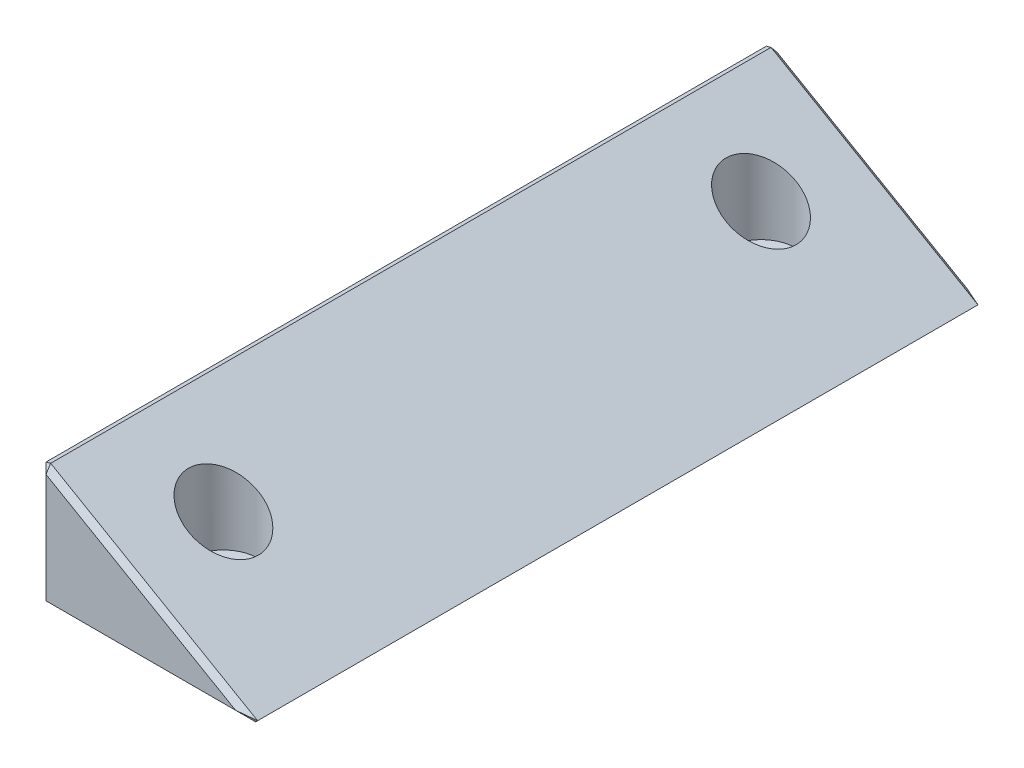
from build123d import *

# Parameters (mm, degrees)
BOSS_EXTRUDE1_DEPTH                                 = 34
CBORE_FOR_M3_HEX_SOCKET_HEAD_CAP_SCREW1_D           = 3.4
CBORE_FOR_M3_HEX_SOCKET_HEAD_CAP_SCREW1_CBORE_D     = 6.5
CBORE_FOR_M3_HEX_SOCKET_HEAD_CAP_SCREW1_CBORE_DEPTH = 10


with BuildPart() as part:
    # Sketch1 → Boss-Extrude1 (new, symmetric)
    with BuildSketch(Plane.XY):
        Polygon((0, 0), (0, -11.547005384), (20, -11.547005384), align=None)
    extrude(amount=BOSS_EXTRUDE1_DEPTH, both=True)

    # CBORE for M3 Hex Socket Head Cap Screw1 (through all)
    with Locations(Plane(origin=(0, 0, 0), x_dir=(1, 0, 0), z_dir=(0, 1, 0))):
        with Locations((8, -25), (8, 25)):
            CounterBoreHole(CBORE_FOR_M3_HEX_SOCKET_HEAD_CAP_SCREW1_D / 2, CBORE_FOR_M3_HEX_SOCKET_HEAD_CAP_SCREW1_CBORE_D / 2, CBORE_FOR_M3_HEX_SOCKET_HEAD_CAP_SCREW1_CBORE_DEPTH)

    # Chamfer1
    # the kernel refuses this chamfer: 0.5, 0.366025404 mm, written as the material it takes off along each edge
    with BuildSketch(Plane(origin=(0.333333333, -11.21367205, 33.666666667), x_dir=(0.7071067811865475, -0.7071067811865476, 0), z_dir=(-0.5773502691896258, -0.5773502691896257, 0.5773502691896256)), Plane(origin=(0.333333333, -11.21367205, -33.666666667), x_dir=(0.7071067811865474, 0, -0.7071067811865476), z_dir=(-0.5773502691896258, -0.5773502691896257, -0.5773502691896257))) as chamfer1_piece_1:
        Polygon((-0.353553391, -0.204124145), (0.353553391, -0.204124145), (0, 0.40824829), align=None)
    extrude(amount=0.635085296, mode=Mode.SUBTRACT)
    with BuildSketch(Plane(origin=(19.105662433, -11.319334483, 33.666666667), x_dir=(-0.8880738339771186, 0.3250575836718637, 0.3250575836718637), z_dir=(0.25056280708572953, -0.2505628070857271, 0.9351131265310311))) as chamfer1_piece_2:
        Polygon((-0.478383292, 0.07914139), (1.059805709, 0.07914139), (-0.581422417, -0.15828278), align=None)
    extrude(amount=0.652121763, mode=Mode.SUBTRACT)
    with BuildSketch(Plane(origin=(19.105662433, -11.319334483, -33.666666667), x_dir=(0.8880738339771186, -0.3250575836718637, 0.3250575836718637), z_dir=(0.25056280708572953, -0.2505628070857271, -0.9351131265310311))) as chamfer1_piece_3:
        Polygon((-1.059805709, 0.07914139), (0.478383292, 0.07914139), (0.581422417, -0.15828278), align=None)
    extrude(amount=0.652121763, mode=Mode.SUBTRACT)
    with BuildSketch(Plane(origin=(0.311004234, -0.494016936, -33.666666667), x_dir=(0.5773502691896288, -0.5773502691896194, -0.5773502691896291), z_dir=(-0.16369153687076843, 0.6109051323707225, -0.7745966692414806))) as chamfer1_piece_4:
        Polygon((-0.349679369, 0.136409614), (0.516346035, 0.136409614), (-0.166666667, -0.272819228), align=None)
    extrude(amount=0.671995646, mode=Mode.SUBTRACT)
    with BuildSketch(Plane(origin=(0.311004234, -0.494016936, 33.666666667), x_dir=(0.5773502691896286, -0.5773502691896196, 0.5773502691896291), z_dir=(-0.1636915368707684, 0.6109051323707224, 0.7745966692414807))) as chamfer1_piece_5:
        Polygon((-0.349679369, -0.136409614), (0.516346035, -0.136409614), (-0.166666667, 0.272819228), align=None)
    extrude(amount=0.671995646, mode=Mode.SUBTRACT)
    with BuildSketch(Plane(origin=(-1.285841494, -11.547005384, 34), x_dir=(0, -0.02749587661058574, -0.9996219169112968), z_dir=(1, 0, 0)), Plane(origin=(-1.285841494, -11.547005384, -34), x_dir=(0, 0.999621916911297, -0.0274958766105822), z_dir=(1, 0, 0))) as chamfer1_piece_6:
        with BuildLine():
            Line((0.514336598, 0), (-0.028273577, 0.513558897))
            Line((-0.028273577, 0.513558897), (-0.038269797, 0.513283938))
            ThreePointArc((-0.038269797, 0.513283938), (-0.017064614, 0.256698915), (-0.009996219, -0.000274959))
            Line((-0.009996219, -0.000274959), (0.000274959, -0.009996219))
            ThreePointArc((0.000274959, -0.009996219), (0.257248832, -0.002927825), (0.514611556, -0.009996219))
            Line((0.514611556, -0.009996219), (0.514336598, 0))
        make_face()
    extrude(amount=22.571682988, mode=Mode.SUBTRACT)
    with BuildSketch(Plane(origin=(8, -11.547005384, -25), x_dir=(-1, 0, 0), z_dir=(0, 0, 1))) as chamfer1_piece_7:
        with BuildLine():
            Line((2.214142136, 0.014142136), (1.685857864, -0.514142136))
            Line((1.685857864, -0.514142136), (1.675857864, -0.514142136))
            ThreePointArc((1.675857864, -0.514142136), (1.69, -0.257071068), (1.69, 0))
            Line((1.69, 0), (1.7, 0.01))
            ThreePointArc((1.7, 0.01), (1.957071068, 0.01), (2.214142136, 0.024142136))
            Line((2.214142136, 0.024142136), (2.214142136, 0.014142136))
        make_face()
    revolve(axis=Axis((8, -11.547005384, -25), (0, -1, 0)), mode=Mode.SUBTRACT)
    with BuildSketch(Plane(origin=(8, -11.547005384, 25), x_dir=(-1, 0, 0), z_dir=(0, 0, 1))) as chamfer1_piece_8:
        with BuildLine():
            Line((2.214142136, 0.014142136), (1.685857864, -0.514142136))
            Line((1.685857864, -0.514142136), (1.675857864, -0.514142136))
            ThreePointArc((1.675857864, -0.514142136), (1.69, -0.257071068), (1.69, 0))
            Line((1.69, 0), (1.7, 0.01))
            ThreePointArc((1.7, 0.01), (1.957071068, 0.01), (2.214142136, 0.024142136))
            Line((2.214142136, 0.024142136), (2.214142136, 0.014142136))
        make_face()
    revolve(axis=Axis((8, -11.547005384, 25), (0, -1, 0)), mode=Mode.SUBTRACT)
    with BuildSketch(Plane(origin=(0, 1.285841494, -34), x_dir=(-0.027495876610586483, 0, 0.9996219169112968), z_dir=(0, -1, 0))) as chamfer1_piece_9:
        with BuildLine():
            Line((0.514336598, 0), (-0.028273577, -0.513558897))
            Line((-0.028273577, -0.513558897), (-0.038269797, -0.513283938))
            ThreePointArc((-0.038269797, -0.513283938), (-0.017064614, -0.256698915), (-0.009996219, 0.000274959))
            Line((-0.009996219, 0.000274959), (0.000274959, 0.009996219))
            ThreePointArc((0.000274959, 0.009996219), (0.257248832, 0.002927825), (0.514611556, 0.009996219))
            Line((0.514611556, 0.009996219), (0.514336598, 0))
        make_face()
    extrude(amount=14.118688372, mode=Mode.SUBTRACT)
    with BuildSketch(Plane(origin=(21.113571399, -12.189926131, -34), x_dir=(-0.4998109584556428, -0.8656979742248838, -0.027495876610582233), z_dir=(-0.8660254037844419, 0.4999999999999943, 0))) as chamfer1_piece_10:
        with BuildLine():
            Line((0.514336598, 0), (-0.028273577, 0.513558897))
            Line((-0.028273577, 0.513558897), (-0.038269797, 0.513283938))
            ThreePointArc((-0.038269797, 0.513283938), (-0.017064614, 0.256698915), (-0.009996219, -0.000274959))
            Line((-0.009996219, -0.000274959), (0.000274959, -0.009996219))
            ThreePointArc((0.000274959, -0.009996219), (0.257248832, -0.002927825), (0.514611556, -0.009996219))
            Line((0.514611556, -0.009996219), (0.514336598, 0))
        make_face()
    extrude(amount=25.665693756, mode=Mode.SUBTRACT)
    with BuildSketch(Plane(origin=(21.113571399, -12.189926131, 34), x_dir=(-0.4998109584556428, -0.8656979742248838, 0.027495876610582233), z_dir=(-0.8660254037844419, 0.4999999999999943, 0))) as chamfer1_piece_11:
        with BuildLine():
            Line((0.514336598, 0), (-0.028273577, -0.513558897))
            Line((-0.028273577, -0.513558897), (-0.038269797, -0.513283938))
            ThreePointArc((-0.038269797, -0.513283938), (-0.017064614, -0.256698915), (-0.009996219, 0.000274959))
            Line((-0.009996219, 0.000274959), (0.000274959, 0.009996219))
            ThreePointArc((0.000274959, 0.009996219), (0.257248832, 0.002927825), (0.514611556, 0.009996219))
            Line((0.514611556, 0.009996219), (0.514336598, 0))
        make_face()
    extrude(amount=25.665693756, mode=Mode.SUBTRACT)
    with BuildSketch(Plane(origin=(0, -11.547005384, -35.285841494), x_dir=(-0.02749587661058639, 0.9996219169112968, 0), z_dir=(0, 0, 1))) as chamfer1_piece_12:
        with BuildLine():
            Line((0.514336598, 0), (-0.028273577, -0.513558897))
            Line((-0.028273577, -0.513558897), (-0.038269797, -0.513283938))
            ThreePointArc((-0.038269797, -0.513283938), (-0.017064614, -0.256698915), (-0.009996219, 0.000274959))
            Line((-0.009996219, 0.000274959), (0.000274959, 0.009996219))
            ThreePointArc((0.000274959, 0.009996219), (0.257248832, 0.002927825), (0.514611556, 0.009996219))
            Line((0.514611556, 0.009996219), (0.514336598, 0))
        make_face()
    extrude(amount=70.571682988, mode=Mode.SUBTRACT)
    with BuildSketch(Plane(origin=(0, 1.285841494, 34), x_dir=(-0.027495876610586483, 0, -0.9996219169112968), z_dir=(0, -1, 0))) as chamfer1_piece_13:
        with BuildLine():
            Line((0.514336598, 0), (-0.028273577, 0.513558897))
            Line((-0.028273577, 0.513558897), (-0.038269797, 0.513283938))
            ThreePointArc((-0.038269797, 0.513283938), (-0.017064614, 0.256698915), (-0.009996219, -0.000274959))
            Line((-0.009996219, -0.000274959), (0.000274959, -0.009996219))
            ThreePointArc((0.000274959, -0.009996219), (0.257248832, -0.002927825), (0.514611556, -0.009996219))
            Line((0.514611556, -0.009996219), (0.514336598, 0))
        make_face()
    extrude(amount=14.118688372, mode=Mode.SUBTRACT)
    with BuildSketch(Plane(origin=(20, -11.547005384, 35.285841494), x_dir=(-0.9996219169112968, -0.02749587661058555, 0), z_dir=(0, 0, -1))) as chamfer1_piece_14:
        with BuildLine():
            Line((0.514336598, 0), (0.297309717, 0.20540729))
            Line((0.297309717, 0.20540729), (0.292073486, 0.21392679))
            ThreePointArc((0.292073486, 0.21392679), (0.148476438, 0.10299394), (-0.005236231, 0.0085195))
            Line((-0.005236231, 0.0085195), (0.000274959, -0.009996219))
            ThreePointArc((0.000274959, -0.009996219), (0.257248832, -0.002927825), (0.514611556, -0.009996219))
            Line((0.514611556, -0.009996219), (0.514336598, 0))
        make_face()
    extrude(amount=70.571682988, mode=Mode.SUBTRACT)
    with BuildSketch(Plane(origin=(0, 0, 35.285841494), x_dir=(-0.05197283076278021, -0.9986484991539833, 0), z_dir=(0, 0, -1))) as chamfer1_piece_15:
        with BuildLine():
            Line((0.371704143, 0), (0.220983806, -0.464444069))
            Line((0.220983806, -0.464444069), (0.212075392, -0.468987213))
            ThreePointArc((0.212075392, -0.468987213), (0.107882689, -0.233552691), (-0.008908414, -0.004543145))
            Line((-0.008908414, -0.004543145), (0.000519728, 0.009986485))
            ThreePointArc((0.000519728, 0.009986485), (0.185869781, 0.000340281), (0.372223871, 0.009986485))
            Line((0.372223871, 0.009986485), (0.371704143, 0))
        make_face()
    extrude(amount=70.571682988, mode=Mode.SUBTRACT)


solid = part.part
